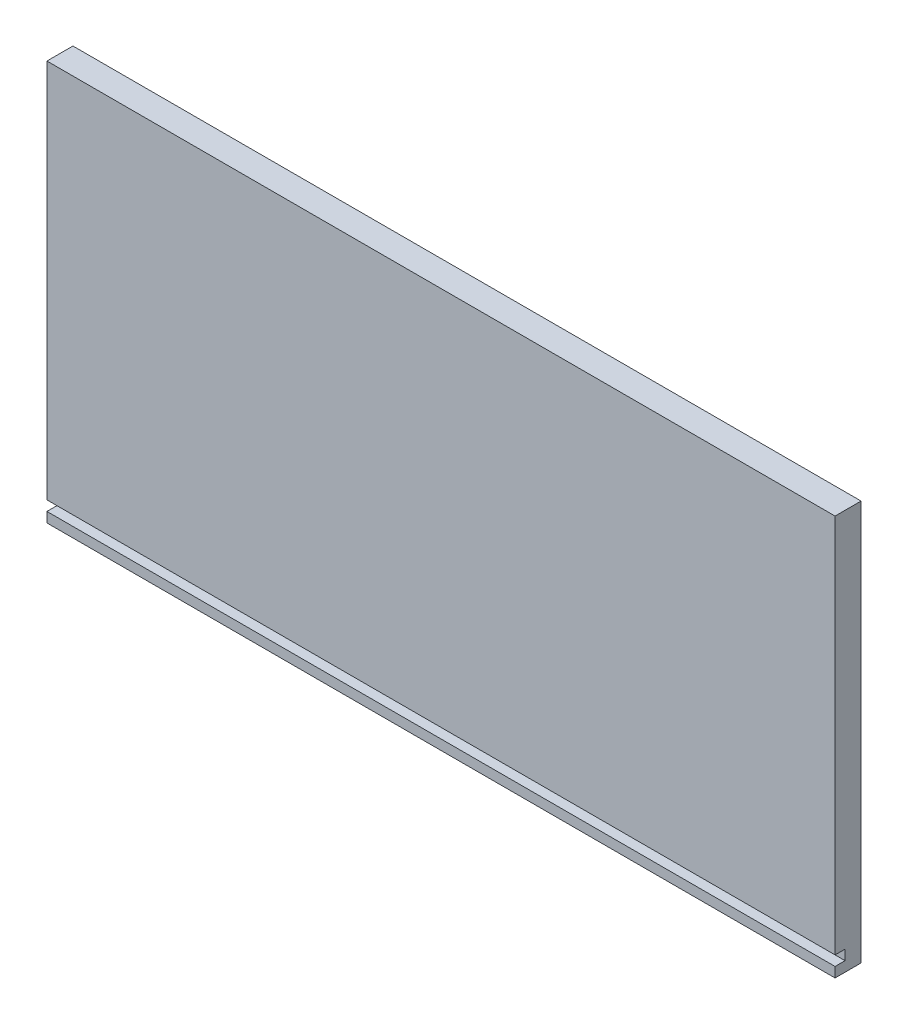
from build123d import *

# Parameters (mm, degrees)
SKETCH_1_W          = 394
SKETCH_1_H          = 200
EXTRUDE_1_DEPTH     = 13
SKETCH_2_W          = 394
SKETCH_2_H          = 5
CUT_EXTRUDE_1_DEPTH = 5


with BuildPart() as part:
    # ｽｹｯﾁ1 → ﾎﾞｽ - 押し出し1 (new body)
    with BuildSketch(Plane.XY):
        with Locations((127.719868277, 61.507142857)):
            Rectangle(SKETCH_1_W, SKETCH_1_H)
    extrude(amount=EXTRUDE_1_DEPTH)

    # ｽｹｯﾁ2 → ｶｯﾄ - 押し出し1 (cut)
    with BuildSketch(Plane.XY.offset(13)):
        with Locations((127.719868277, -30.992857143)):
            Rectangle(SKETCH_2_W, SKETCH_2_H)
    extrude(amount=-CUT_EXTRUDE_1_DEPTH, mode=Mode.SUBTRACT)


solid = part.part
